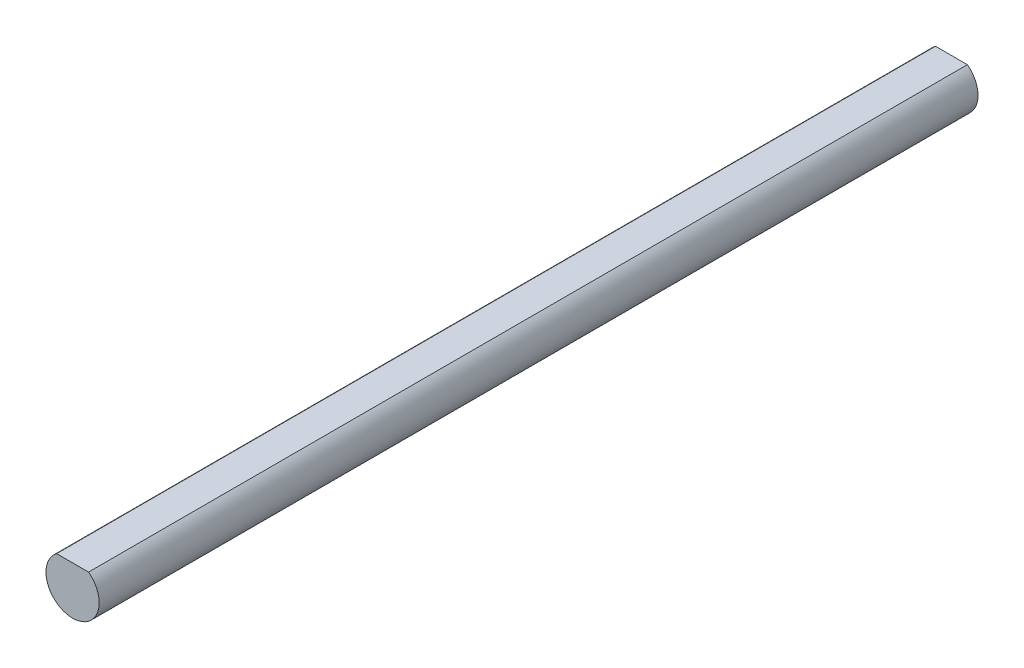
from build123d import *

# Parameters (mm, degrees)
BOSS_EXTRUDE1_DEPTH = 82.55


with BuildPart() as part:
    # Sketch1 → Boss-Extrude1 (new body)
    with BuildSketch(Plane.XY):
        with BuildLine():
            Line((-1.5, 2), (1.5, 2))
            ThreePointArc((1.5, 2), (0, -2.5), (-1.5, 2))
        make_face()
    extrude(amount=BOSS_EXTRUDE1_DEPTH)


solid = part.part
